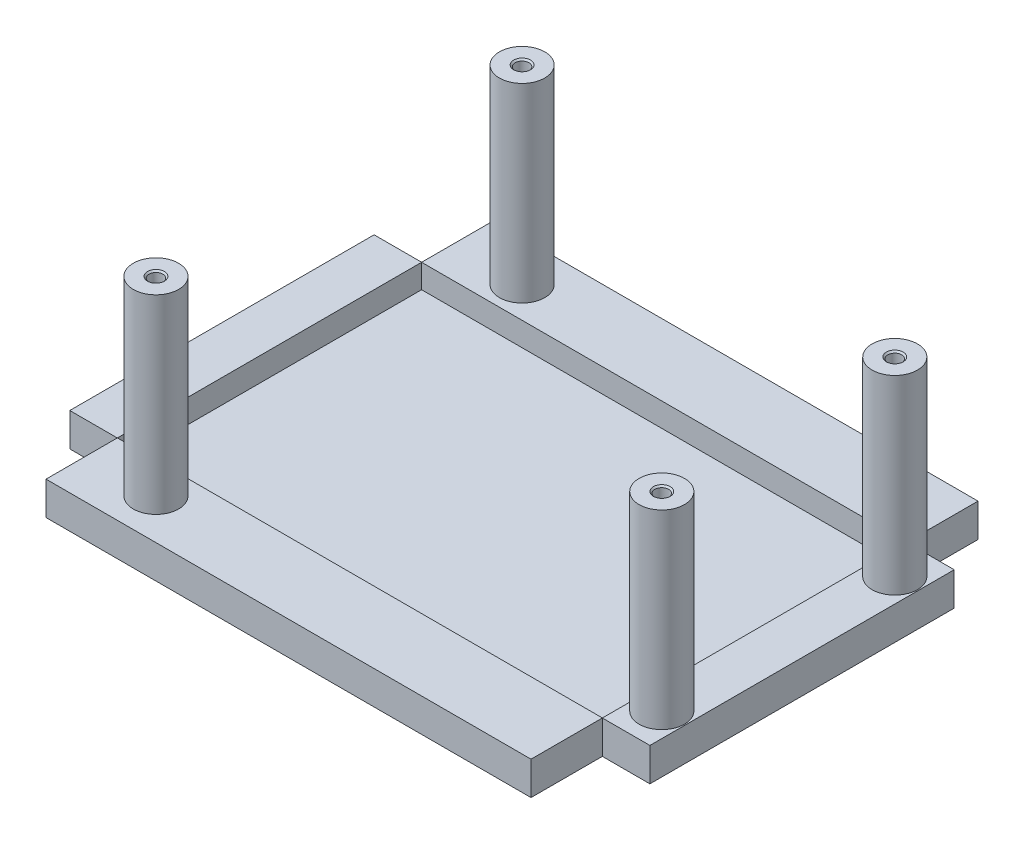
from build123d import *

# Parameters (mm, degrees)
EXTRUDE_7_DEPTH                = 7
SKETCH_3_W                     = 102
SKETCH_3_H                     = 63.98
CUT_EXTRUDE_5_DEPTH            = 5
SKETCH_4_R                     = 4.771914111
EXTRUDE_10_DEPTH               = 40
HOLE_WIZARD_M3_5_1_D           = 2.9
HOLE_WIZARD_M3_5_1_DEPTH       = 10
HOLE_WIZARD_M3_5_1_CSINK_D     = 3.55
HOLE_WIZARD_M3_5_1_CSINK_ANGLE = 90
HOLE_WIZARD_M3_5_1_TIP         = 0.871247898
SKETCH_11_R                    = 4.77
EXTRUDE_11_DEPTH               = 40
SKETCH_11_3_R                  = 4.77
EXTRUDE_12_DEPTH               = 40
HOLE_WIZARD_M3_5_2_D           = 2.9
HOLE_WIZARD_M3_5_2_DEPTH       = 10
HOLE_WIZARD_M3_5_2_CSINK_D     = 3.55
HOLE_WIZARD_M3_5_2_CSINK_ANGLE = 90
HOLE_WIZARD_M3_5_2_TIP         = 0.871247898


with BuildPart() as part:
    # 草图1 → 凸台-拉伸7 (new body)
    with BuildSketch(Plane(origin=(0, 0, 0), x_dir=(1, 0, 0), z_dir=(0, 1, 0))):
        Polygon((0, 79), (0, 64), (-10, 64), (-10, 0), (0, 0), (0, -15), (102, -15), (102, 0), (112, 0), (112, 64), (102, 64), (102, 79), align=None)
    extrude(amount=EXTRUDE_7_DEPTH)

    # 草图3 → 切除-拉伸5 (cut)
    with BuildSketch(Plane(origin=(0, 7, 0), x_dir=(1, 0, 0), z_dir=(0, 1, 0))):
        with Locations((51, 32)):
            Rectangle(SKETCH_3_W, SKETCH_3_H)
    extrude(amount=-CUT_EXTRUDE_5_DEPTH, mode=Mode.SUBTRACT)

    # 草图4 → 凸台-拉伸10 (add)
    with BuildSketch(Plane(origin=(0, 7, 0), x_dir=(1, 0, 0), z_dir=(0, 1, 0))):
        with Locations((107, 56.5)):
            Circle(SKETCH_4_R)
        with Locations((107, 7.5)):
            Circle(SKETCH_4_R)
    extrude(amount=EXTRUDE_10_DEPTH)

    # M3.5 螺纹孔1
    with Locations(Plane(origin=(0, 47, 0), x_dir=(1, 0, 0), z_dir=(0, 1, 0))):
        with Locations((107, 56.5), (107, 7.5)):
            CounterSinkHole(HOLE_WIZARD_M3_5_1_D / 2, HOLE_WIZARD_M3_5_1_CSINK_D / 2, depth=HOLE_WIZARD_M3_5_1_DEPTH, counter_sink_angle=HOLE_WIZARD_M3_5_1_CSINK_ANGLE)
            with Locations((0, 0, -(HOLE_WIZARD_M3_5_1_DEPTH + HOLE_WIZARD_M3_5_1_TIP / 2))):  # 118° drill point
                Cone(0, HOLE_WIZARD_M3_5_1_D / 2, HOLE_WIZARD_M3_5_1_TIP, mode=Mode.SUBTRACT)

    # 草图11 → 凸台-拉伸11 (add)
    with BuildSketch(Plane(origin=(0, 7, 0), x_dir=(1, 0, 0), z_dir=(0, 1, 0))):
        with Locations((14.623767602, 70.5)):
            Circle(SKETCH_11_R)
    extrude(amount=EXTRUDE_11_DEPTH)

    # 草图11<3> → 凸台-拉伸12 (add)
    with BuildSketch(Plane(origin=(0, 7, 0), x_dir=(1, 0, 0), z_dir=(0, 1, 0))):
        with Locations((14.623767602, 70.5)):
            Circle(SKETCH_11_3_R)
        with Locations((14.623767602, -6.5)):
            Circle(SKETCH_11_3_R)
    extrude(amount=EXTRUDE_12_DEPTH)

    # M3.5 螺纹孔2
    with Locations(Plane(origin=(0, 47, 0), x_dir=(1, 0, 0), z_dir=(0, 1, 0))):
        with Locations((14.623767602, 70.5), (14.623767602, -6.5)):
            CounterSinkHole(HOLE_WIZARD_M3_5_2_D / 2, HOLE_WIZARD_M3_5_2_CSINK_D / 2, depth=HOLE_WIZARD_M3_5_2_DEPTH, counter_sink_angle=HOLE_WIZARD_M3_5_2_CSINK_ANGLE)
            with Locations((0, 0, -(HOLE_WIZARD_M3_5_2_DEPTH + HOLE_WIZARD_M3_5_2_TIP / 2))):  # 118° drill point
                Cone(0, HOLE_WIZARD_M3_5_2_D / 2, HOLE_WIZARD_M3_5_2_TIP, mode=Mode.SUBTRACT)


solid = part.part
